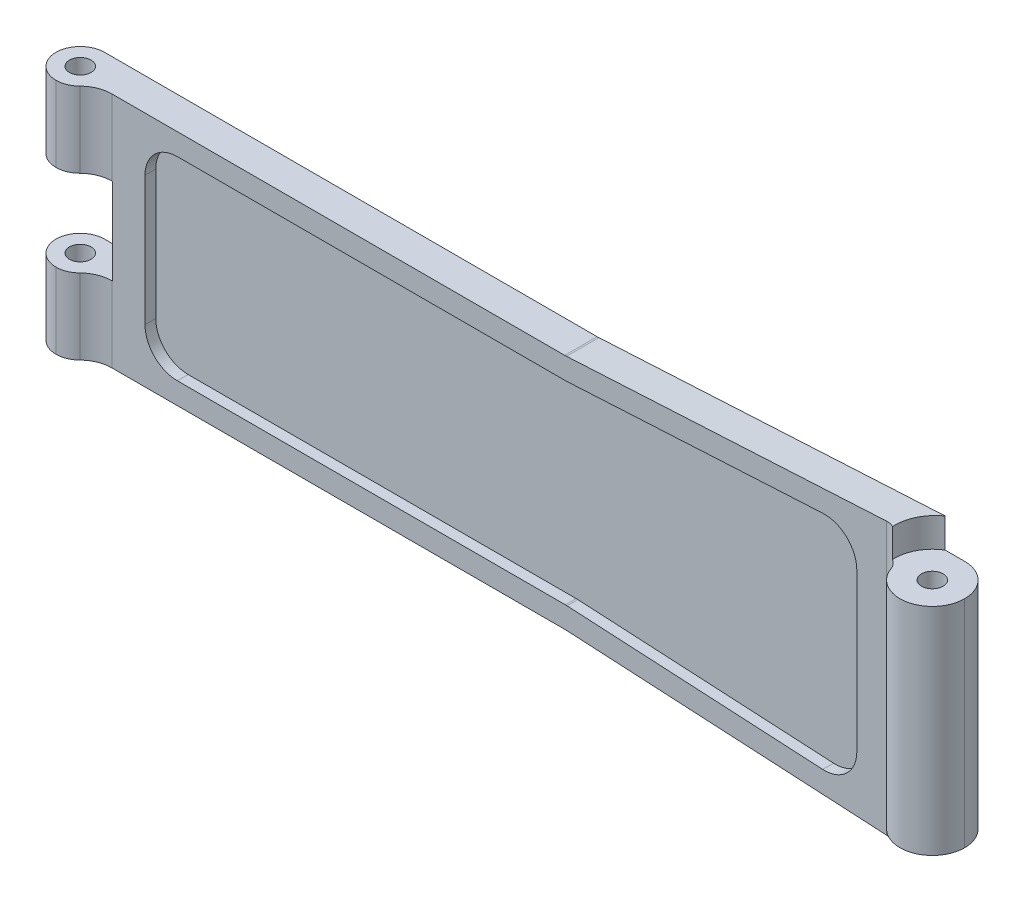
from build123d import *

# Parameters (mm, degrees)
SALIENTE_EXTRUIR1_DEPTH = 3
CORTAR_EXTRUIR1_DEPTH   = 1
CROQUIS8_R              = 3
SALIENTE_EXTRUIR2_DEPTH = 12.5
REDONDEO1_R             = 3
CROQUIS9_R              = 3.5
CORTAR_EXTRUIR3_DEPTH   = 3
REDONDEO2_R             = 1.5
CROQUIS10_R             = 1
CORTAR_EXTRUIR4_DEPTH   = 15
REDONDEO3_R             = 3
SALIENTE_EXTRUIR3_DEPTH = 11
REDONDEO4_R             = 2.25
CROQUIS12_W             = 10
CROQUIS12_H             = 8
CORTAR_EXTRUIR5_DEPTH   = 22
CROQUIS13_R             = 1
CORTAR_EXTRUIR6_DEPTH   = 26
REDONDEO5_R             = 3
REDONDEO6_R             = 3


# Some blends are built 0.0001 mm under size
with BuildPart() as part:
    # Croquis1 → Saliente-Extruir1 (new body)
    with BuildSketch(Plane.XY):
        Polygon((0, 11), (-48, 11), (-48, -11), (0, -11), (37, -13), (37, 13), align=None)
    extrude(amount=SALIENTE_EXTRUIR1_DEPTH)

    # Croquis7 → Cortar-Extruir1 (cut)
    with BuildSketch(Plane.XY.offset(3)):
        Polygon((-39, 9), (-39, -9), (0.054014627, -9), (27, -10.45653975), (27, 10.45653975), (0.054014627, 9), align=None)
    extrude(amount=-CORTAR_EXTRUIR1_DEPTH, mode=Mode.SUBTRACT)

    # Croquis8 → Saliente-Extruir2 (add, symmetric)
    with BuildSketch(Plane(origin=(0, 0, 0), x_dir=(1, 0, 0), z_dir=(0, 1, 0))):
        with Locations((34, -3)):
            Circle(CROQUIS8_R)
    extrude(amount=SALIENTE_EXTRUIR2_DEPTH, both=True)

    # Redondeo1
    redondeo1_edges = [part.edges().sort_by_distance(p)[0] for p in [
        (37, 0, 0),
    ]]
    fillet(redondeo1_edges, radius=REDONDEO1_R - 0.0001)  # a hair under: the kernel refuses the full size

    # Croquis9 → Cortar-Extruir3 (cut)
    with BuildSketch(Plane(origin=(0, -13, 0), x_dir=(1, 0, 0), z_dir=(0, 1, 0))):
        with Locations((34, -3)):
            Circle(CROQUIS9_R)
    cortar_extruir3 = extrude(amount=CORTAR_EXTRUIR3_DEPTH, mode=Mode.SUBTRACT)

    # Simetría1: Cortar-Extruir3 across plane
    add(cortar_extruir3.mirror(Plane.ZX), mode=Mode.SUBTRACT)

    # Redondeo2
    redondeo2_edges = [part.edges().sort_by_distance(p)[0] for p in [
        (31, 0, 3),
    ]]
    fillet(redondeo2_edges, radius=REDONDEO2_R)

    # Croquis10 → Cortar-Extruir4 (cut, symmetric)
    with BuildSketch(Plane(origin=(0, 0, 0), x_dir=(1, 0, 0), z_dir=(0, 1, 0))):
        with Locations(Location((34, -3, 0), (0, 0, 270))):
            Circle(CROQUIS10_R)
    extrude(amount=CORTAR_EXTRUIR4_DEPTH, both=True, mode=Mode.SUBTRACT)

    # Redondeo3
    # the kernel refuses this fillet: 3 mm, written as the material it adds along each edge
    with BuildSketch(Plane(origin=(-39, -9, 3), x_dir=(0, 1, 0), z_dir=(0, 0, -1))) as redondeo3_piece_1:
        with BuildLine():
            CenterArc((REDONDEO3_R, REDONDEO3_R), REDONDEO3_R, 180, 90)
            Line((0, REDONDEO3_R), (0, 0))
            Line((0, 0), (REDONDEO3_R, 0))
        make_face()
    extrude(amount=1)
    with BuildSketch(Plane(origin=(-39, 9, 3), x_dir=(0, -1, 0), z_dir=(0, 0, -1))) as redondeo3_piece_2:
        with BuildLine():
            CenterArc((REDONDEO3_R, -REDONDEO3_R), REDONDEO3_R, 90, 90)
            Line((0, -REDONDEO3_R), (0, 0))
            Line((0, 0), (REDONDEO3_R, 0))
        make_face()
    extrude(amount=1)
    with BuildSketch(Plane(origin=(27, 10.45653975, 3), x_dir=(-0.9985422732775083, -0.053975258015000575, 0), z_dir=(0, 0, -1))) as redondeo3_piece_3:
        with BuildLine():
            CenterArc((REDONDEO3_R * 1.05551390885, -REDONDEO3_R), REDONDEO3_R, 90, 93.094058059)
            Line((REDONDEO3_R * 0.0569716355684, -REDONDEO3_R * 1.05397525801), (0, 0))
            Line((0, 0), (REDONDEO3_R * 1.05551390885, 0))
        make_face()
    extrude(amount=1)
    with BuildSketch(Plane(origin=(27, -10.45653975, 3), x_dir=(-0.9985422732775082, 0.053975258015002685, 0), z_dir=(0, 0, -1))) as redondeo3_piece_4:
        with BuildLine():
            CenterArc((REDONDEO3_R * 1.05551390885, REDONDEO3_R), REDONDEO3_R, 176.905941941, 93.094058059)
            Line((REDONDEO3_R * 0.0569716355684, REDONDEO3_R * 1.05397525802), (0, 0))
            Line((0, 0), (REDONDEO3_R * 1.05551390885, 0))
        make_face()
    extrude(amount=1)
    # the kernel refuses this fillet: 3 mm, written as the material it takes off along each edge
    with BuildSketch(Plane(origin=(0.054014627, 9, 3.202554852), x_dir=(-1, 0, 0), z_dir=(0, 0, -1))) as redondeo3_2_piece_1:
        with BuildLine():
            CenterArc((REDONDEO3_R * 0.0270073136489, REDONDEO3_R), REDONDEO3_R, 266.905941941, 3.094058059)
            Line((-REDONDEO3_R * 0.0269679443661, REDONDEO3_R * 0.00145772672249), (0, 0))
            Line((0, 0), (REDONDEO3_R * 0.0270073136489, 0))
        make_face()
    extrude(amount=1.202554852, mode=Mode.SUBTRACT)
    with BuildSketch(Plane(origin=(0.054014627, -9, 3.202554852), x_dir=(-1, 0, 0), z_dir=(0, 0, -1))) as redondeo3_2_piece_2:
        with BuildLine():
            CenterArc((REDONDEO3_R * 0.0270073136489, -REDONDEO3_R), REDONDEO3_R, 90, 3.094058059)
            Line((-REDONDEO3_R * 0.0269679443661, -REDONDEO3_R * 0.00145772672249), (0, 0))
            Line((0, 0), (REDONDEO3_R * 0.0270073136489, 0))
        make_face()
    extrude(amount=1.202554852, mode=Mode.SUBTRACT)

    # Croquis11 → Saliente-Extruir3 (add, symmetric)
    with BuildSketch(Plane(origin=(0, 0, 0), x_dir=(1, 0, 0), z_dir=(0, 1, 0))):
        with BuildLine():
            Line((-48, -4.5), (-45.75, -4.5))
            ThreePointArc((-45.75, -4.5), (-44.159009742, -3.840990258), (-43.5, -2.25))
            Line((-43.5, -2.25), (-43.5, 0))
            Line((-43.5, 0), (-48, 0))
            Line((-48, 0), (-48, -4.5))
        make_face()
    extrude(amount=SALIENTE_EXTRUIR3_DEPTH, both=True)

    # Redondeo4
    redondeo4_edges = [part.edges().sort_by_distance(p)[0] for p in [
        (-48, 0, 0),
        (-48, 0, 4.5),
    ]]
    fillet(redondeo4_edges, radius=REDONDEO4_R - 0.0001)  # a hair under: the kernel refuses the full size

    # Croquis12 → Cortar-Extruir5 (cut)
    with BuildSketch(Plane(origin=(0, 0, 0), x_dir=(-1, 0, 0), z_dir=(0, 0, -1))):
        with Locations((47, 0)):
            Rectangle(CROQUIS12_W, CROQUIS12_H)
    extrude(amount=-CORTAR_EXTRUIR5_DEPTH, mode=Mode.SUBTRACT)

    # Croquis13 → Cortar-Extruir6 (cut, symmetric)
    with BuildSketch(Plane(origin=(0, 0, 0), x_dir=(1, 0, 0), z_dir=(0, 1, 0))):
        with Locations(Location((-45.75, -2.25, 0), (0, 0, 180))):
            Circle(CROQUIS13_R)
    extrude(amount=CORTAR_EXTRUIR6_DEPTH, both=True, mode=Mode.SUBTRACT)

    # Redondeo5
    redondeo5_edges = [part.edges().sort_by_distance(p)[0] for p in [
        (-43.628679656, 7.5, 3),
        (-43.628679656, -7.5, 3),
    ]]
    fillet(redondeo5_edges, radius=REDONDEO5_R)

    # Redondeo6
    # the kernel refuses this fillet: 3 mm, written as the material it adds along each edge
    with BuildSketch(Plane(origin=(0, 11, 0), x_dir=(-1, 0, 0), z_dir=(0, 0, 1))) as redondeo6_piece_1:
        with BuildLine():
            CenterArc((REDONDEO6_R * 0.0270073136489, -REDONDEO6_R), REDONDEO6_R, 90, 3.094058059)
            Line((-REDONDEO6_R * 0.0269679443661, -REDONDEO6_R * 0.00145772672249), (0, 0))
            Line((0, 0), (REDONDEO6_R * 0.0270073136489, 0))
        make_face()
    extrude(amount=3)
    with BuildSketch(Plane(origin=(0, -11, 0), x_dir=(-1, 0, 0), z_dir=(0, 0, 1))) as redondeo6_piece_2:
        with BuildLine():
            CenterArc((REDONDEO6_R * 0.0270073136489, REDONDEO6_R), REDONDEO6_R, 266.905941941, 3.094058059)
            Line((-REDONDEO6_R * 0.0269679443661, REDONDEO6_R * 0.00145772672249), (0, 0))
            Line((0, 0), (REDONDEO6_R * 0.0270073136489, 0))
        make_face()
    extrude(amount=3)


solid = part.part
